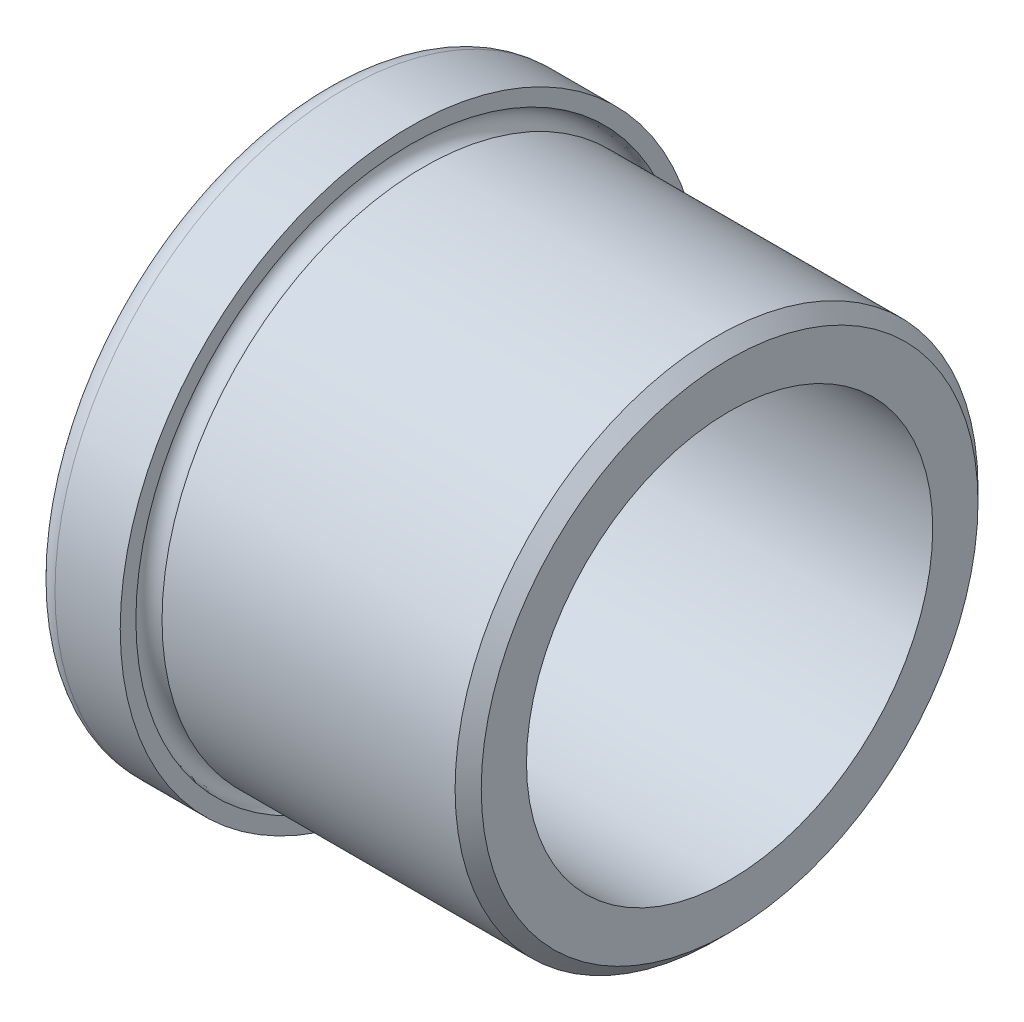
from build123d import *


with BuildPart() as part:
    # Sketch1 → BaseBody (revolve)
    with BuildSketch(Plane.XY):
        with BuildLine():
            Line((0, 24.6126), (0, 29.3624))
            ThreePointArc((0, 29.3624), (0.699311849, 31.050688151), (2.3876, 31.75))
            Line((2.3876, 31.75), (9.525, 31.75))
            Line((9.525, 31.75), (9.525, 30.0370875))
            ThreePointArc((9.525, 30.0370875), (8.513598654, 27.595348654), (10.9553375, 28.60675))
            Line((10.9553375, 28.60675), (43.0196625, 28.60675))
            Line((43.0196625, 28.60675), (44.45, 27.1764125))
            Line((44.45, 27.1764125), (44.45, 22.225))
            Line((44.45, 22.225), (2.3876, 22.225))
            ThreePointArc((2.3876, 22.225), (0.699311849, 22.924311849), (0, 24.6126))
        make_face()
    revolve(axis=Axis((0, 0, 0), (1, 0, 0)))


solid = part.part
